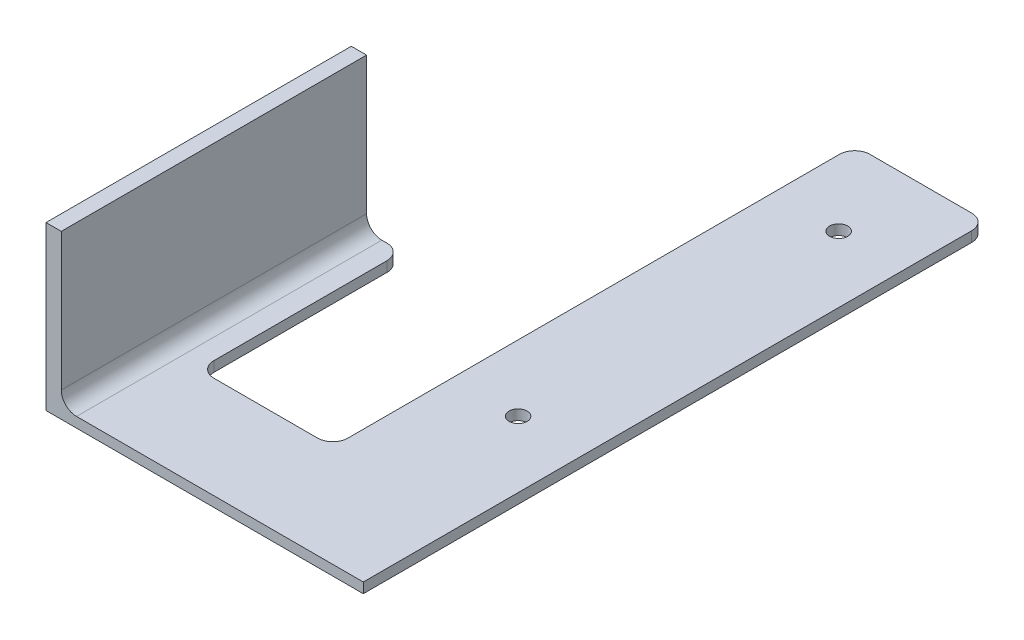
from build123d import *

# Parameters (mm, degrees)
SKETCH1_W           = 121.182243879
SKETCH1_H           = 155.659
SKETCH1_R           = 2.25
BOSS_EXTRUDE1_DEPTH = 2.54
SKETCH8_W           = 33.472243879
SKETCH8_H           = 130.259
SKETCH8_W_2         = 41.99
SKETCH8_H_2         = 155.659
CUT_EXTRUDE5_DEPTH  = 2.54
SKETCH9_W           = 3.81
SKETCH9_H           = 76.2
BOSS_EXTRUDE3_DEPTH = 38.1
FILLET3_R           = 3.81
CUT_EXTRUDE6_DEPTH  = 38.1
FILLET4_R           = 3.81
FILLET5_R           = 3.81


with BuildPart() as part:
    # Sketch1 → Boss-Extrude1 (new body)
    with BuildSketch(Plane(origin=(0, 0, 0), x_dir=(1, 0, 0), z_dir=(0, 1, 0))):
        with Locations((-61.52891038, -3.27030316)):
            Rectangle(SKETCH1_W, SKETCH1_H)
        with Locations((-59.43778844, -25.95080316)):
            Circle(SKETCH1_R, mode=Mode.SUBTRACT)
        with Locations((-59.43778844, 54.04919684)):
            Circle(SKETCH1_R, mode=Mode.SUBTRACT)
    extrude(amount=BOSS_EXTRUDE1_DEPTH)

    # Sketch8 → Cut-Extrude5 (cut)
    with BuildSketch(Plane(origin=(0, 2.54, 0), x_dir=(1, 0, 0), z_dir=(0, 1, 0))):
        with Locations((-92.68391038, 9.42969684)):
            Rectangle(SKETCH8_W, SKETCH8_H)
        with Locations((-21.93278844, -3.27030316)):
            Rectangle(SKETCH8_W_2, SKETCH8_H_2)
    extrude(amount=-CUT_EXTRUDE5_DEPTH, mode=Mode.SUBTRACT)

    # Sketch9 → Boss-Extrude3 (add)
    with BuildSketch(Plane(origin=(0, 2.54, 0), x_dir=(1, 0, 0), z_dir=(0, 1, 0))):
        with Locations((-120.215032319, -42.99980316)):
            Rectangle(SKETCH9_W, SKETCH9_H)
    extrude(amount=BOSS_EXTRUDE3_DEPTH)

    # Fillet3
    fillet3_edges = [part.edges().sort_by_distance(p)[0] for p in [
        (-118.310032319, 2.54, 42.99980316),
    ]]
    fillet(fillet3_edges, radius=FILLET3_R)

    # Sketch10 → Cut-Extrude6 (cut)
    with BuildSketch(Plane(origin=(0, 2.54, 0), x_dir=(1, 0, 0), z_dir=(0, 1, 0))):
        Polygon((-122.120032319, -4.89980316), (-114.500032319, -4.89980316), (-109.420032319, -4.89980316), (-109.420032319, 74.55919684), (-122.120032319, 74.55919684), align=None)
    extrude(amount=-CUT_EXTRUDE6_DEPTH, mode=Mode.SUBTRACT)

    # Fillet4
    fillet4_edges = [part.edges().sort_by_distance(p)[0] for p in [
        (-75.94778844, 1.27, 55.69980316),
        (-109.420032319, 1.27, 55.69980316),
    ]]
    fillet(fillet4_edges, radius=FILLET4_R)

    # Fillet5
    fillet5_edges = [part.edges().sort_by_distance(p)[0] for p in [
        (-42.92778844, 1.27, -74.55919684),
        (-75.94778844, 1.27, -74.55919684),
        (-109.420032319, 1.27, 4.89980316),
    ]]
    fillet(fillet5_edges, radius=FILLET5_R)


solid = part.part
